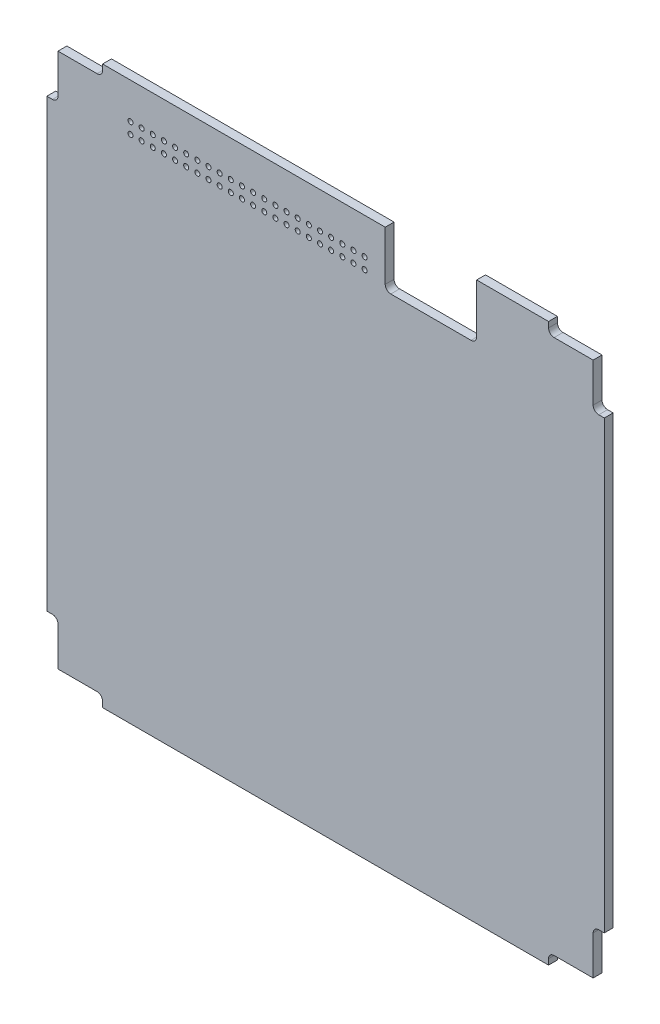
from build123d import *

# Parameters (mm, degrees)
BOSS_EXTRUDE1_DEPTH = 1.5875
FILLET1_R           = 1
SKETCH2_R           = 0.45
CUT_EXTRUDE1_DEPTH  = 71.728496069
CUT_EXTRUDE2_DEPTH  = 9.8806
FILLET2_R           = 1


with BuildPart() as part:
    # Sketch1 → Boss-Extrude1 (new body)
    with BuildSketch(Plane.XY):
        Polygon((40, 50), (-40, 50), (-40, 48), (-48, 48), (-48, 40), (-50, 40), (-50, -37.864895224), (-50, -40), (-48, -40), (-48, -48), (-40, -48), (-40, -50), (-37.864895224, -50), (40, -50), (40, -48), (48, -48), (48, -40), (50, -40), (50, 40), (48, 40), (48, 48), (40, 48), align=None)
    extrude(amount=BOSS_EXTRUDE1_DEPTH)

    # Fillet1
    fillet1_edges = [part.edges().sort_by_distance(p)[0] for p in [
        (-48, -40, 0.79375),
        (-40, -48, 0.79375),
        (40, -48, 0.79375),
        (48, -40, 0.79375),
        (48, 40, 0.79375),
        (40, 48, 0.79375),
        (-40, 48, 0.79375),
        (-48, 40, 0.79375),
    ]]
    fillet(fillet1_edges, radius=FILLET1_R)

    # Sketch2 → Cut-Extrude1 (cut, through all)
    with BuildSketch(Plane.XY.offset(1.5875)):
        with Locations((-35, 43.55)):
            Circle(SKETCH2_R)
        with Locations((-33, 43.55)):
            Circle(SKETCH2_R)
        with Locations((-31, 43.55)):
            Circle(SKETCH2_R)
        with Locations((-29, 43.55)):
            Circle(SKETCH2_R)
        with Locations((-27, 43.55)):
            Circle(SKETCH2_R)
        with Locations((-25, 43.55)):
            Circle(SKETCH2_R)
        with Locations((-23, 43.55)):
            Circle(SKETCH2_R)
        with Locations((-21, 43.55)):
            Circle(SKETCH2_R)
        with Locations((-19, 43.55)):
            Circle(SKETCH2_R)
        with Locations((-17, 43.55)):
            Circle(SKETCH2_R)
        with Locations((-15, 43.55)):
            Circle(SKETCH2_R)
        with Locations((-13, 43.55)):
            Circle(SKETCH2_R)
        with Locations((-11, 43.55)):
            Circle(SKETCH2_R)
        with Locations((-9, 43.55)):
            Circle(SKETCH2_R)
        with Locations((-7, 43.55)):
            Circle(SKETCH2_R)
        with Locations((-5, 43.55)):
            Circle(SKETCH2_R)
        with Locations((-3, 43.55)):
            Circle(SKETCH2_R)
        with Locations((-1, 43.55)):
            Circle(SKETCH2_R)
        with Locations((1, 43.55)):
            Circle(SKETCH2_R)
        with Locations((3, 43.55)):
            Circle(SKETCH2_R)
        with Locations((5, 43.55)):
            Circle(SKETCH2_R)
        with Locations((7, 43.55)):
            Circle(SKETCH2_R)
        with Locations((-33, 41.55)):
            Circle(SKETCH2_R)
        with Locations((-31, 41.55)):
            Circle(SKETCH2_R)
        with Locations((-29, 41.55)):
            Circle(SKETCH2_R)
        with Locations((-27, 41.55)):
            Circle(SKETCH2_R)
        with Locations((-25, 41.55)):
            Circle(SKETCH2_R)
        with Locations((-23, 41.55)):
            Circle(SKETCH2_R)
        with Locations((-21, 41.55)):
            Circle(SKETCH2_R)
        with Locations((-19, 41.55)):
            Circle(SKETCH2_R)
        with Locations((-17, 41.55)):
            Circle(SKETCH2_R)
        with Locations((-15, 41.55)):
            Circle(SKETCH2_R)
        with Locations((-13, 41.55)):
            Circle(SKETCH2_R)
        with Locations((-11, 41.55)):
            Circle(SKETCH2_R)
        with Locations((-9, 41.55)):
            Circle(SKETCH2_R)
        with Locations((-7, 41.55)):
            Circle(SKETCH2_R)
        with Locations((-5, 41.55)):
            Circle(SKETCH2_R)
        with Locations((-3, 41.55)):
            Circle(SKETCH2_R)
        with Locations((-1, 41.55)):
            Circle(SKETCH2_R)
        with Locations((1, 41.55)):
            Circle(SKETCH2_R)
        with Locations((3, 41.55)):
            Circle(SKETCH2_R)
        with Locations((5, 41.55)):
            Circle(SKETCH2_R)
        with Locations((7, 41.55)):
            Circle(SKETCH2_R)
        with Locations((-35, 41.55)):
            Circle(SKETCH2_R)
    extrude(amount=-CUT_EXTRUDE1_DEPTH, mode=Mode.SUBTRACT)

    # Sketch3 → Cut-Extrude2 (cut)
    with BuildSketch(Plane(origin=(0, 50, 0), x_dir=(1, 0, 0), z_dir=(0, 1, 0))):
        Polygon((10.7, 0), (19.7, 0), (27.1, 0), (27.1, -1.5875), (19.7, -1.5875), (10.7, -1.5875), align=None)
    extrude(amount=-CUT_EXTRUDE2_DEPTH, mode=Mode.SUBTRACT)

    # Fillet2
    fillet2_edges = [part.edges().sort_by_distance(p)[0] for p in [
        (10.7, 40.1194, 0.79375),
        (27.1, 40.1194, 0.79375),
    ]]
    fillet(fillet2_edges, radius=FILLET2_R)


solid = part.part
